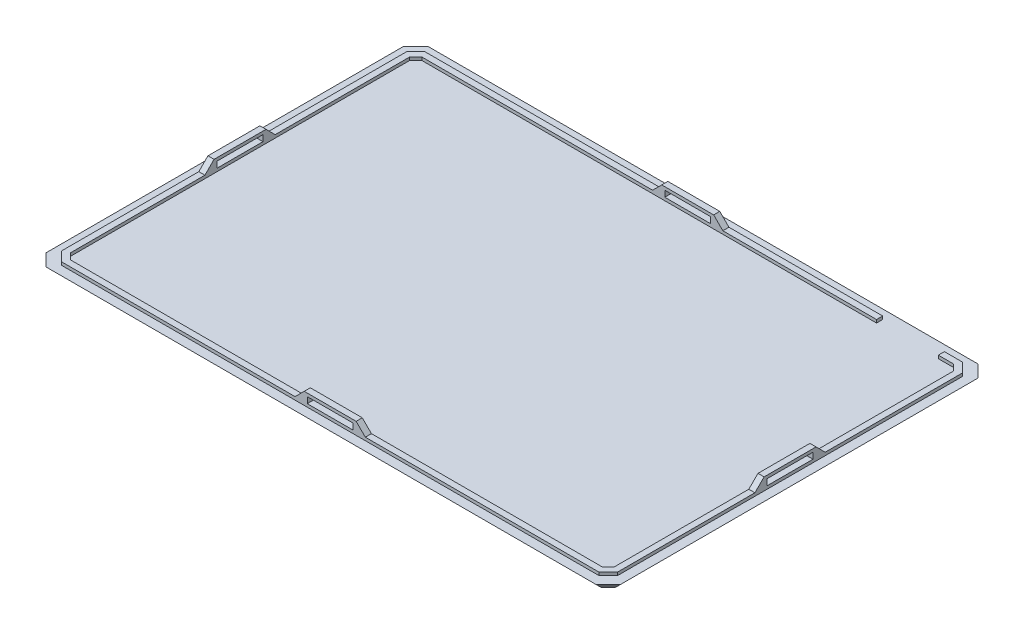
from build123d import *

# Parameters (mm, degrees)
SKETCH_1_W          = 188
SKETCH_1_H          = 125
EXTRUDE_1_DEPTH     = 3
SKETCH_2_W          = 182
SKETCH_2_H          = 119
SKETCH_2_W_2        = 178
SKETCH_2_H_2        = 115
EXTRUDE_2_DEPTH     = 1
CUT_EXTRUDE_1_REACH = 156.042
SKETCH_4_W          = 20.2
SKETCH_4_H          = 1
SKETCH_5_W          = 15
SKETCH_5_H          = 2
SKETCH_5_W_2        = 2
SKETCH_5_H_2        = 15
EXTRUDE_3_DEPTH     = 3
CHAMFER_1_SIZE      = 4
CUT_EXTRUDE_2_REACH = 156.065
SKETCH_6_W          = 15
SKETCH_6_H          = 2
CUT_EXTRUDE_3_REACH = 197.313
SKETCH_7_W          = 15
SKETCH_7_H          = 2
SKETCH_8_R          = 12.5
EXTRUDE_4_DEPTH     = 2
SKETCH_9_R          = 10
CUT_EXTRUDE_4_DEPTH = 2
CHAMFER_2_SIZE      = 4
CHAMFER_3_SIZE      = 3
CHAMFER_4_SIZE      = 2
CHAMFER_5_SIZE      = 3


# Some blends are built 0.0001 mm under size
with BuildPart() as part:
    # 草图1 → 凸台-拉伸1 (new body)
    with BuildSketch(Plane(origin=(0, 0, 0), x_dir=(1, 0, 0), z_dir=(0, 1, 0))):
        Rectangle(SKETCH_1_W, SKETCH_1_H)
    extrude(amount=-EXTRUDE_1_DEPTH)

    # 草图2 → 凸台-拉伸2 (add)
    with BuildSketch(Plane(origin=(0, 0, 0), x_dir=(1, 0, 0), z_dir=(0, 1, 0))):
        Rectangle(SKETCH_2_W, SKETCH_2_H)
        Rectangle(SKETCH_2_W_2, SKETCH_2_H_2, mode=Mode.SUBTRACT)
    extrude(amount=EXTRUDE_2_DEPTH)

    # 草图4 → 切除-拉伸1 (cut, up to next)
    with BuildSketch(Plane(origin=(0, 0, -59.5), x_dir=(-1, 0, 0), z_dir=(0, 0, -1)), mode=Mode.PRIVATE) as cut_extrude_1_sk1:
        with Locations((-71.9, 0.5)):
            Rectangle(SKETCH_4_W, SKETCH_4_H)
    cut_extrude_1_tool1 = extrude(cut_extrude_1_sk1.sketch, amount=-CUT_EXTRUDE_1_REACH, mode=Mode.PRIVATE) & part.part
    add(cut_extrude_1_tool1.solids().sort_by_distance((71.9, 0.5, -59.5))[0], mode=Mode.SUBTRACT)

    # 草图5 → 凸台-拉伸3 (add)
    with BuildSketch(Plane(origin=(0, 1, 0), x_dir=(1, 0, 0), z_dir=(0, 1, 0))):
        with Locations((0, -58.5)):
            Rectangle(SKETCH_5_W, SKETCH_5_H)
        with Locations((90, 0)):
            Rectangle(SKETCH_5_W_2, SKETCH_5_H_2)
        with Locations((0, 58.5)):
            Rectangle(SKETCH_5_W, SKETCH_5_H)
        with Locations((-90, 0)):
            Rectangle(SKETCH_5_W_2, SKETCH_5_H_2)
    extrude(amount=EXTRUDE_3_DEPTH)

    # 倒角1
    # the kernel refuses this chamfer: 4 mm, written as the material it adds along each edge
    with BuildSketch(Plane(origin=(-89, 1, -7.5), x_dir=(0, -0.027495876610586372, -0.9996219169112968), z_dir=(-1, 0, 0))) as chamfer_1_piece_1_section:
        Polygon((CHAMFER_1_SIZE * 0.999621916911, -CHAMFER_1_SIZE * 0.0274958766106), (-CHAMFER_1_SIZE * 0.0274958766106, -CHAMFER_1_SIZE * 0.999621916911), (0, 0), align=None)
    chamfer_1_piece_1 = extrude(amount=2, mode=Mode.PRIVATE)
    chamfer_1_piece_1 = split(chamfer_1_piece_1, bisect_by=Plane(origin=(-90, 4, -8.907836441), z_dir=(0, -1, 0)), keep=Keep.TOP, mode=Mode.PRIVATE)
    add(chamfer_1_piece_1)
    with BuildSketch(Plane(origin=(-91, 1, 7.5), x_dir=(0, -0.027495876610586382, 0.9996219169112968), z_dir=(1, 0, 0))) as chamfer_1_piece_2_section:
        Polygon((CHAMFER_1_SIZE * 0.999621916911, -CHAMFER_1_SIZE * 0.0274958766106), (-CHAMFER_1_SIZE * 0.0274958766106, -CHAMFER_1_SIZE * 0.999621916911), (0, 0), align=None)
    chamfer_1_piece_2 = extrude(amount=2, mode=Mode.PRIVATE)
    chamfer_1_piece_2 = split(chamfer_1_piece_2, bisect_by=Plane(origin=(-90, 4, 8.907836441), z_dir=(0, -1, 0)), keep=Keep.TOP, mode=Mode.PRIVATE)
    add(chamfer_1_piece_2)
    with BuildSketch(Plane(origin=(-7.5, 1, 57.5), x_dir=(-0.9996219169112968, -0.027495876610586382, 0), z_dir=(0, 0, 1))) as chamfer_1_piece_3_section:
        Polygon((CHAMFER_1_SIZE * 0.999621916911, -CHAMFER_1_SIZE * 0.0274958766106), (-CHAMFER_1_SIZE * 0.0274958766106, -CHAMFER_1_SIZE * 0.999621916911), (0, 0), align=None)
    chamfer_1_piece_3 = extrude(amount=2, mode=Mode.PRIVATE)
    chamfer_1_piece_3 = split(chamfer_1_piece_3, bisect_by=Plane(origin=(-8.907836441, 4, 58.5), z_dir=(0, -1, 0)), keep=Keep.TOP, mode=Mode.PRIVATE)
    add(chamfer_1_piece_3)
    with BuildSketch(Plane(origin=(7.5, 1, 59.5), x_dir=(0.9996219169112968, -0.02749587661058638, 0), z_dir=(0, 0, -1))) as chamfer_1_piece_4_section:
        Polygon((CHAMFER_1_SIZE * 0.999621916911, -CHAMFER_1_SIZE * 0.0274958766106), (-CHAMFER_1_SIZE * 0.0274958766106, -CHAMFER_1_SIZE * 0.999621916911), (0, 0), align=None)
    chamfer_1_piece_4 = extrude(amount=2, mode=Mode.PRIVATE)
    chamfer_1_piece_4 = split(chamfer_1_piece_4, bisect_by=Plane(origin=(8.907836441, 4, 58.5), z_dir=(0, -1, 0)), keep=Keep.TOP, mode=Mode.PRIVATE)
    add(chamfer_1_piece_4)
    with BuildSketch(Plane(origin=(89, 1, 7.5), x_dir=(0, -0.027495876610586372, 0.9996219169112968), z_dir=(1, 0, 0))) as chamfer_1_piece_5_section:
        Polygon((CHAMFER_1_SIZE * 0.999621916911, -CHAMFER_1_SIZE * 0.0274958766106), (-CHAMFER_1_SIZE * 0.0274958766106, -CHAMFER_1_SIZE * 0.999621916911), (0, 0), align=None)
    chamfer_1_piece_5 = extrude(amount=2, mode=Mode.PRIVATE)
    chamfer_1_piece_5 = split(chamfer_1_piece_5, bisect_by=Plane(origin=(90, 4, 8.907836441), z_dir=(0, -1, 0)), keep=Keep.TOP, mode=Mode.PRIVATE)
    add(chamfer_1_piece_5)
    with BuildSketch(Plane(origin=(91, 1, -7.5), x_dir=(0, -0.02749587661058638, -0.9996219169112968), z_dir=(-1, 0, 0))) as chamfer_1_piece_6_section:
        Polygon((CHAMFER_1_SIZE * 0.999621916911, -CHAMFER_1_SIZE * 0.0274958766106), (-CHAMFER_1_SIZE * 0.0274958766106, -CHAMFER_1_SIZE * 0.999621916911), (0, 0), align=None)
    chamfer_1_piece_6 = extrude(amount=2, mode=Mode.PRIVATE)
    chamfer_1_piece_6 = split(chamfer_1_piece_6, bisect_by=Plane(origin=(90, 4, -8.907836441), z_dir=(0, -1, 0)), keep=Keep.TOP, mode=Mode.PRIVATE)
    add(chamfer_1_piece_6)
    with BuildSketch(Plane(origin=(-7.5, 1, -59.5), x_dir=(-0.9996219169112968, -0.02749587661058638, 0), z_dir=(0, 0, 1))) as chamfer_1_piece_7_section:
        Polygon((CHAMFER_1_SIZE * 0.999621916911, -CHAMFER_1_SIZE * 0.0274958766106), (-CHAMFER_1_SIZE * 0.0274958766106, -CHAMFER_1_SIZE * 0.999621916911), (0, 0), align=None)
    chamfer_1_piece_7 = extrude(amount=2, mode=Mode.PRIVATE)
    chamfer_1_piece_7 = split(chamfer_1_piece_7, bisect_by=Plane(origin=(-8.907836441, 4, -58.5), z_dir=(0, -1, 0)), keep=Keep.TOP, mode=Mode.PRIVATE)
    add(chamfer_1_piece_7)
    with BuildSketch(Plane(origin=(7.5, 1, -57.5), x_dir=(0.9996219169112968, -0.027495876610586372, 0), z_dir=(0, 0, -1))) as chamfer_1_piece_8_section:
        Polygon((CHAMFER_1_SIZE * 0.999621916911, -CHAMFER_1_SIZE * 0.0274958766106), (-CHAMFER_1_SIZE * 0.0274958766106, -CHAMFER_1_SIZE * 0.999621916911), (0, 0), align=None)
    chamfer_1_piece_8 = extrude(amount=2, mode=Mode.PRIVATE)
    chamfer_1_piece_8 = split(chamfer_1_piece_8, bisect_by=Plane(origin=(8.907836441, 4, -58.5), z_dir=(0, -1, 0)), keep=Keep.TOP, mode=Mode.PRIVATE)
    add(chamfer_1_piece_8)

    # 切除-拉伸2: up to this face of the body (flat: up to its plane)
    cut_extrude_2_end = Plane(part.part.faces().sort_by_distance((0, 0.977272727, 59.5))[0])
    # 草图6 → 切除-拉伸2 (cut, up to the picked face)
    with BuildSketch(Plane(origin=(0, 0, -59.5), x_dir=(-1, 0, 0), z_dir=(0, 0, -1)), mode=Mode.PRIVATE) as cut_extrude_2_sk1:
        with Locations((0, 2)):
            Rectangle(SKETCH_6_W, SKETCH_6_H)
    cut_extrude_2_tool1 = split(extrude(cut_extrude_2_sk1.sketch, amount=-CUT_EXTRUDE_2_REACH, mode=Mode.PRIVATE), bisect_by=cut_extrude_2_end, keep=Keep.BOTH, mode=Mode.PRIVATE)
    add(cut_extrude_2_tool1.solids().sort_by(Axis((0, 2, -59.5), (0, 0, 1)))[0], mode=Mode.SUBTRACT)

    # 切除-拉伸3: up to this face of the body (flat: up to its plane)
    cut_extrude_3_end = Plane(part.part.faces().sort_by_distance((91, 1.145251397, 0))[0])
    # 草图7 → 切除-拉伸3 (cut, up to the picked face)
    with BuildSketch(Plane.ZY.offset(91), mode=Mode.PRIVATE) as cut_extrude_3_sk1:
        with Locations((0, 2)):
            Rectangle(SKETCH_7_W, SKETCH_7_H)
    cut_extrude_3_tool1 = split(extrude(cut_extrude_3_sk1.sketch, amount=-CUT_EXTRUDE_3_REACH, mode=Mode.PRIVATE), bisect_by=cut_extrude_3_end, keep=Keep.BOTH, mode=Mode.PRIVATE)
    add(cut_extrude_3_tool1.solids().sort_by(Axis((-91, 2, 0), (1, 0, 0)))[0], mode=Mode.SUBTRACT)

    # 草图8 → 凸台-拉伸4 (add)
    with BuildSketch(Plane.XZ.offset(3)):
        with Locations(Location((-64, 37.5, 0), (0, 0, 90))):
            Circle(SKETCH_8_R)
        with Locations(Location((-64, -37.5, 0), (0, 0, 90))):
            Circle(SKETCH_8_R)
        with Locations(Location((64, 37.5, 0), (0, 0, 90))):
            Circle(SKETCH_8_R)
        with Locations(Location((64, -37.5, 0), (0, 0, 90))):
            Circle(SKETCH_8_R)
    extrude(amount=EXTRUDE_4_DEPTH)

    # 草图9 → 切除-拉伸4 (cut)
    with BuildSketch(Plane.XZ.offset(3)):
        with Locations(Location((-64, 37.5, 0), (0, 0, 270))):
            Circle(SKETCH_9_R)
        with Locations(Location((-64, -37.5, 0), (0, 0, 90))):
            Circle(SKETCH_9_R)
        with Locations(Location((64, 37.5, 0), (0, 0, 90))):
            Circle(SKETCH_9_R)
        with Locations(Location((64, -37.5, 0), (0, 0, 270))):
            Circle(SKETCH_9_R)
    extrude(amount=CUT_EXTRUDE_4_DEPTH, mode=Mode.SUBTRACT)

    # 倒角2
    chamfer_2_edges = [part.edges().sort_by_distance(p)[0] for p in [
        (-94, -1.5, -62.5),
        (94, -1.5, -62.5),
        (94, -1.5, 62.5),
        (-94, -1.5, 62.5),
    ]]
    chamfer(chamfer_2_edges, length=CHAMFER_2_SIZE)

    # 倒角3
    chamfer_3_edges = [part.edges().sort_by_distance(p)[0] for p in [
        (92, -3, -60.5),
        (0, -3, -62.5),
        (-92, -3, -60.5),
        (-94, -3, 0),
        (-92, -3, 60.5),
        (0, -3, 62.5),
        (92, -3, 60.5),
        (94, -3, 0),
    ]]
    chamfer(chamfer_3_edges, length=CHAMFER_3_SIZE - 0.0001)  # a hair under: the kernel refuses the full size

    # 倒角4
    chamfer_4_edges = [part.edges().sort_by_distance(p)[0] for p in [
        (-89, 0.5, 57.5),
        (89, 0.5, 57.5),
        (89, 0.5, -57.5),
        (-89, 0.5, -57.5),
    ]]
    chamfer(chamfer_4_edges, length=CHAMFER_4_SIZE)

    # 倒角5
    chamfer_5_edges = [part.edges().sort_by_distance(p)[0] for p in [
        (-91, 0.5, -59.5),
        (-91, 0.5, 59.5),
        (91, 0.5, 59.5),
        (91, 0.5, -59.5),
    ]]
    chamfer(chamfer_5_edges, length=CHAMFER_5_SIZE)


solid = part.part
